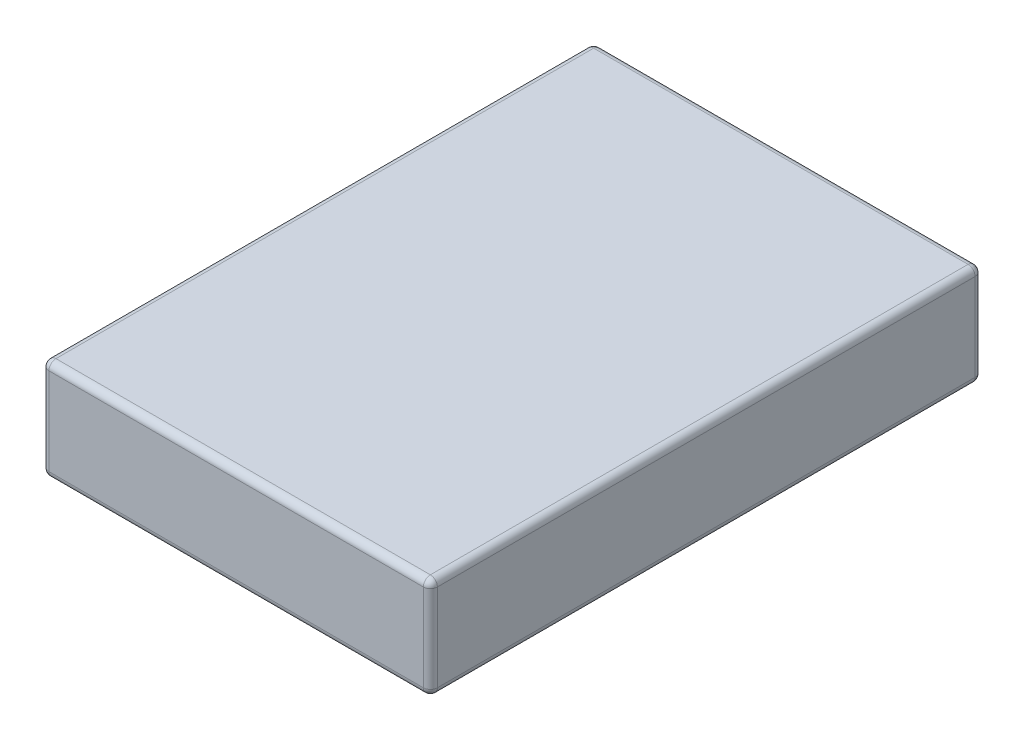
from build123d import *

# Parameters (mm, degrees)
BOSS_EXTRUDE1_DEPTH = 36
FILLET1_R           = 2.5


with BuildPart() as part:
    # Sketch1 → Boss-Extrude1 (new body)
    with BuildSketch(Plane(origin=(0, 0, 0), x_dir=(1, 0, 0), z_dir=(0, 1, 0))):
        with BuildLine():
            Line((66.5, -98), (-66.5, -98))
            ThreePointArc((-66.5, -98), (-68.267766953, -97.267766953), (-69, -95.5))
            Line((-69, -95.5), (-69, 95.5))
            ThreePointArc((-69, 95.5), (-68.267766953, 97.267766953), (-66.5, 98))
            Line((-66.5, 98), (66.5, 98))
            ThreePointArc((66.5, 98), (68.267766953, 97.267766953), (69, 95.5))
            Line((69, 95.5), (69, -95.5))
            ThreePointArc((69, -95.5), (68.267766953, -97.267766953), (66.5, -98))
        make_face()
    extrude(amount=BOSS_EXTRUDE1_DEPTH)

    # Fillet1
    fillet1_edges = [part.edges().sort_by_distance(p)[0] for p in [
        (0, 0, 98),
        (68.267766953, 0, 97.267766953),
        (69, 0, 0),
        (68.267766953, 0, -97.267766953),
        (0, 0, -98),
        (-68.267766953, 0, -97.267766953),
        (-69, 0, 0),
        (-68.267766953, 0, 97.267766953),
        (-69, 36, 0),
        (-68.267766953, 36, -97.267766953),
        (0, 36, -98),
        (68.267766953, 36, -97.267766953),
        (69, 36, 0),
        (68.267766953, 36, 97.267766953),
        (0, 36, 98),
        (-68.267766953, 36, 97.267766953),
    ]]
    fillet(fillet1_edges, radius=FILLET1_R)


solid = part.part
